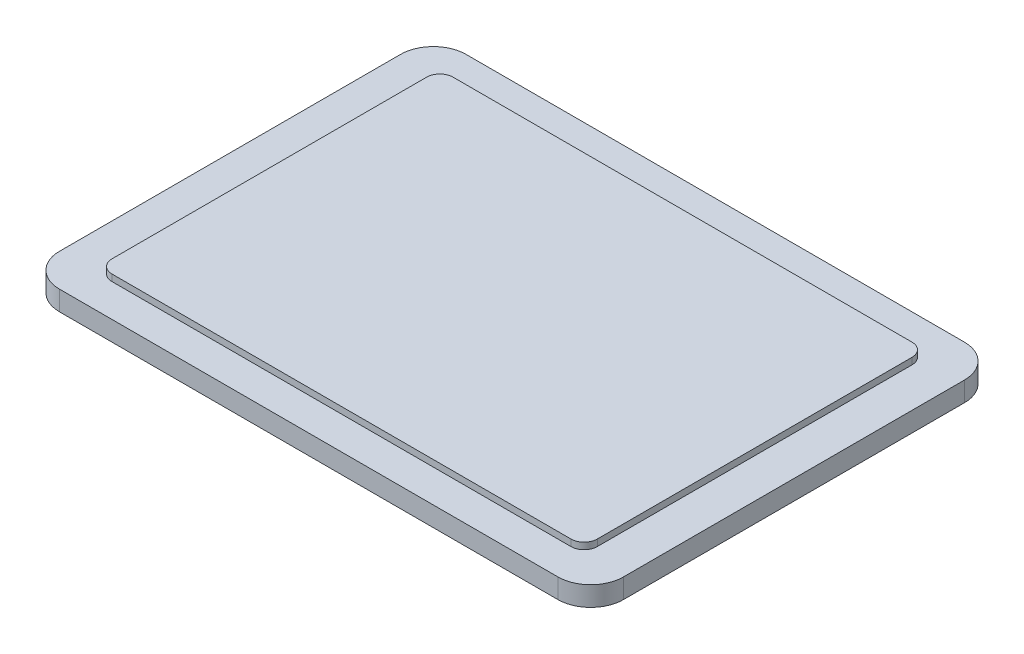
from build123d import *

# Parameters (mm, degrees)
SKETCH_1_W      = 86
SKETCH_1_H      = 62
EXTRUDE_1_DEPTH = 3
SKETCH_2_W      = 74
SKETCH_2_H      = 52
EXTRUDE_2_DEPTH = 1
FILLET_1_R      = 5
FILLET_2_R      = 2


with BuildPart() as part:
    # 草图1 → 凸台-拉伸1 (new body)
    with BuildSketch(Plane(origin=(0, 0, 0), x_dir=(1, 0, 0), z_dir=(0, 1, 0))):
        Rectangle(SKETCH_1_W, SKETCH_1_H)
    extrude(amount=EXTRUDE_1_DEPTH)

    # 草图2 → 凸台-拉伸2 (add)
    with BuildSketch(Plane(origin=(0, 3, 0), x_dir=(1, 0, 0), z_dir=(0, 1, 0))):
        Rectangle(SKETCH_2_W, SKETCH_2_H)
    extrude(amount=EXTRUDE_2_DEPTH)

    # 圆角1
    fillet_1_edges = [part.edges().sort_by_distance(p)[0] for p in [
        (-43, 1.5, -31),
        (43, 1.5, -31),
        (43, 1.5, 31),
        (-43, 1.5, 31),
    ]]
    fillet(fillet_1_edges, radius=FILLET_1_R)

    # 圆角2
    fillet_2_edges = [part.edges().sort_by_distance(p)[0] for p in [
        (37, 3.5, 26),
        (-37, 3.5, 26),
        (37, 3.5, -26),
        (-37, 3.5, -26),
    ]]
    fillet(fillet_2_edges, radius=FILLET_2_R)


solid = part.part
